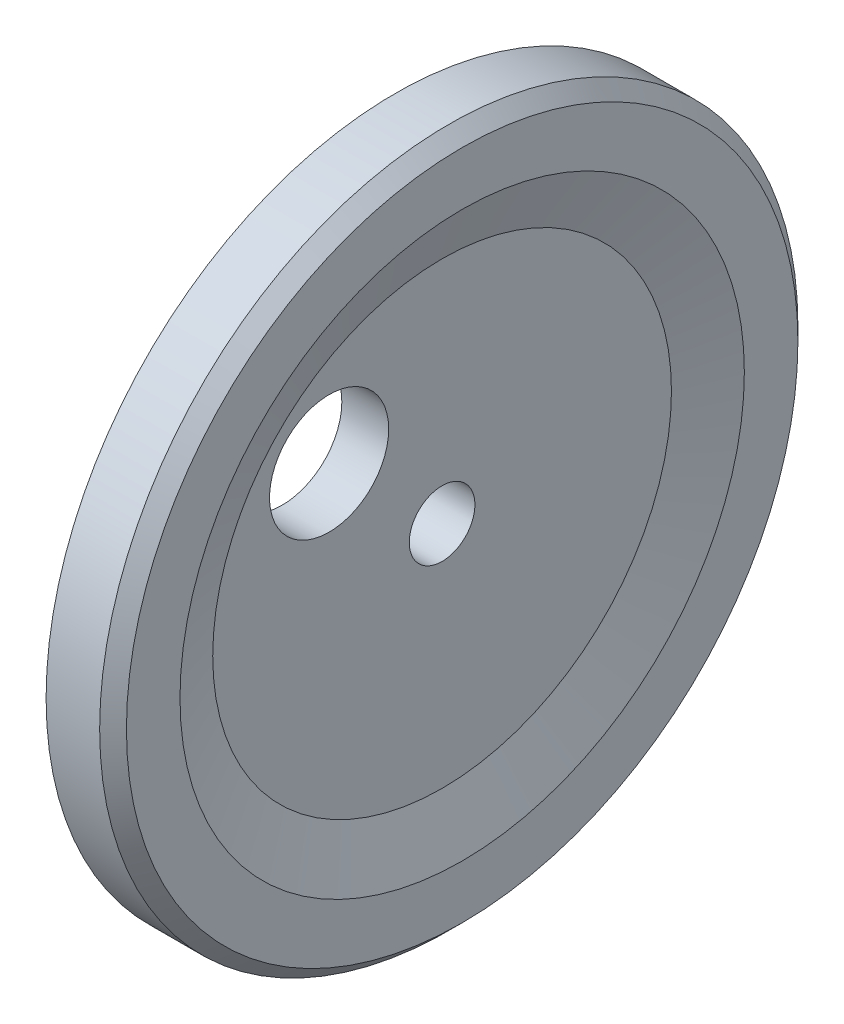
from build123d import *

# Parameters (mm, degrees)
CHAMFER1_SIZE      = 2
SKETCH3_R          = 8.9
CUT_EXTRUDE1_DEPTH = 10


with BuildPart() as part:
    # Sketch1 → Revolve1 (revolve)
    with BuildSketch(Plane(origin=(0, 0, 0), x_dir=(1, 0, 0), z_dir=(0, 1, 0))):
        Polygon((0, 4.9022), (0, 52.15), (10, 52.15), (10, 42.15), (7, 34.26), (7, 4.9022), align=None)
    revolve(axis=Axis((0, 0, 0), (1, 0, 0)))

    # Chamfer1
    chamfer1_edges = [part.edges().sort_by_distance(p)[0] for p in [
        (10, 0, 52.15),
    ]]
    chamfer(chamfer1_edges, length=CHAMFER1_SIZE)

    # Sketch3 → Cut-Extrude1 (cut)
    with BuildSketch(Plane(origin=(7, 0, 0), x_dir=(0, 0, -1), z_dir=(1, 0, 0))):
        with Locations((-16.875192026, 16.225331227)):
            Circle(SKETCH3_R)
    extrude(amount=-CUT_EXTRUDE1_DEPTH, mode=Mode.SUBTRACT)


solid = part.part
